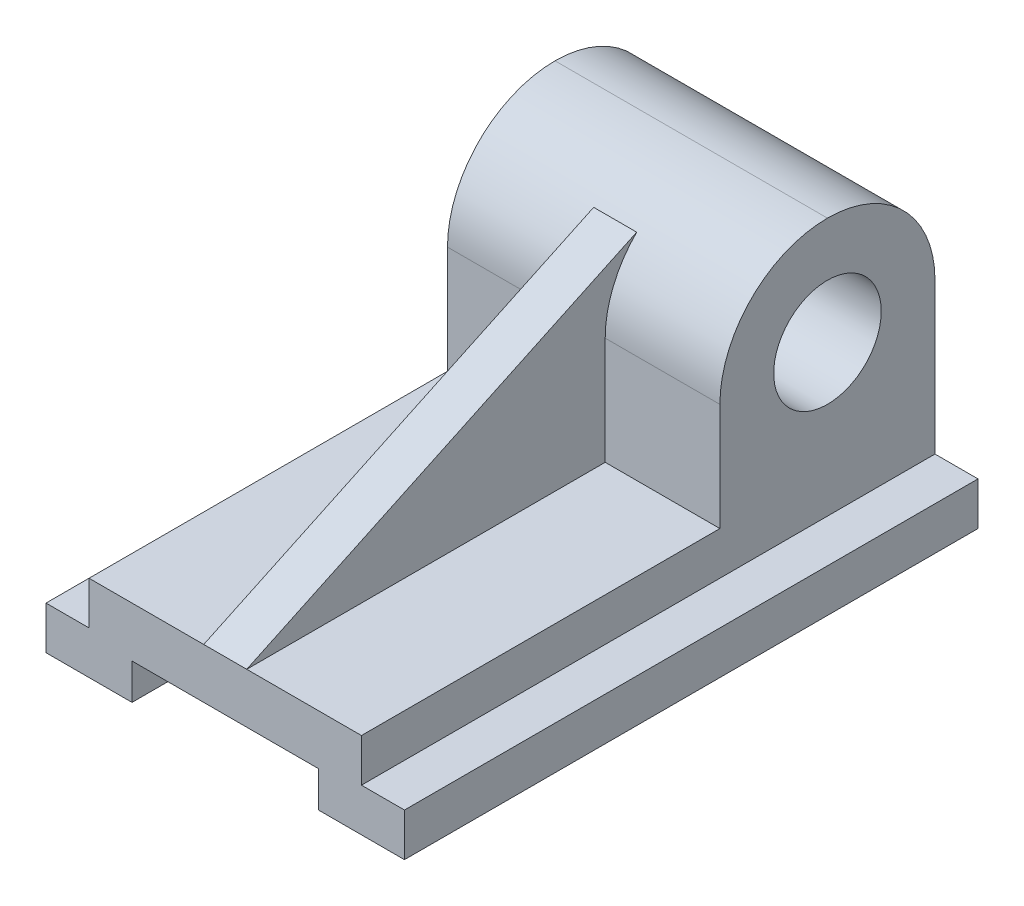
from build123d import *

# Parameters (mm, degrees)
BOSS_EXTRUDE1_DEPTH = 160
SKETCH2_W           = 76
SKETCH2_H           = 60
BOSS_EXTRUDE2_DEPTH = 60
FILLET1_R           = 30
SKETCH3_R           = 15
CUT_EXTRUDE1_DEPTH  = 201.997512422
RIB1_REACH          = 189.499
SKETCH7_WALL_W      = 497.237426276
SKETCH7_WALL_H      = 12


with BuildPart() as part:
    # Sketch1 → Boss-Extrude1 (new body)
    with BuildSketch(Plane.XY):
        Polygon((-38, 24), (38, 24), (38, 12), (50, 12), (50, 0), (26, 0), (26, 10), (-26, 10), (-26, 0), (-50, 0), (-50, 12), (-38, 12), align=None)
    extrude(amount=-BOSS_EXTRUDE1_DEPTH)

    # Sketch2 → Boss-Extrude2 (add)
    with BuildSketch(Plane(origin=(0, 24, 0), x_dir=(1, 0, 0), z_dir=(0, 1, 0))):
        with Locations((0, 130)):
            Rectangle(SKETCH2_W, SKETCH2_H)
    extrude(amount=BOSS_EXTRUDE2_DEPTH)

    # Fillet1
    fillet1_edges = [part.edges().sort_by_distance(p)[0] for p in [
        (0, 84, -160),
        (0, 84, -100),
    ]]
    fillet(fillet1_edges, radius=FILLET1_R - 0.0001)  # a hair under: the kernel refuses the full size

    # Sketch3 → Cut-Extrude1 (cut, through all)
    with BuildSketch(Plane(origin=(38, 0, 0), x_dir=(0, 0, -1), z_dir=(1, 0, 0))):
        with Locations((130, 54)):
            Circle(SKETCH3_R)
    extrude(amount=-CUT_EXTRUDE1_DEPTH, mode=Mode.SUBTRACT)

    # Sketch7 wall → Rib1 (add, up to next)
    with BuildSketch(Plane(origin=(0, 49.606601718, -54.393398282), x_dir=(0, 0.42592923947, -0.904756477161), z_dir=(0, 0.904756477161, 0.42592923947)), mode=Mode.PRIVATE) as rib1_sk1:
        Rectangle(SKETCH7_WALL_W, SKETCH7_WALL_H)
    rib1_tool1 = extrude(rib1_sk1.sketch, amount=-RIB1_REACH, mode=Mode.PRIVATE) - part.part
    add(rib1_tool1.solids().sort_by_distance((0, 49.606601718, -54.393398282))[0])


solid = part.part
